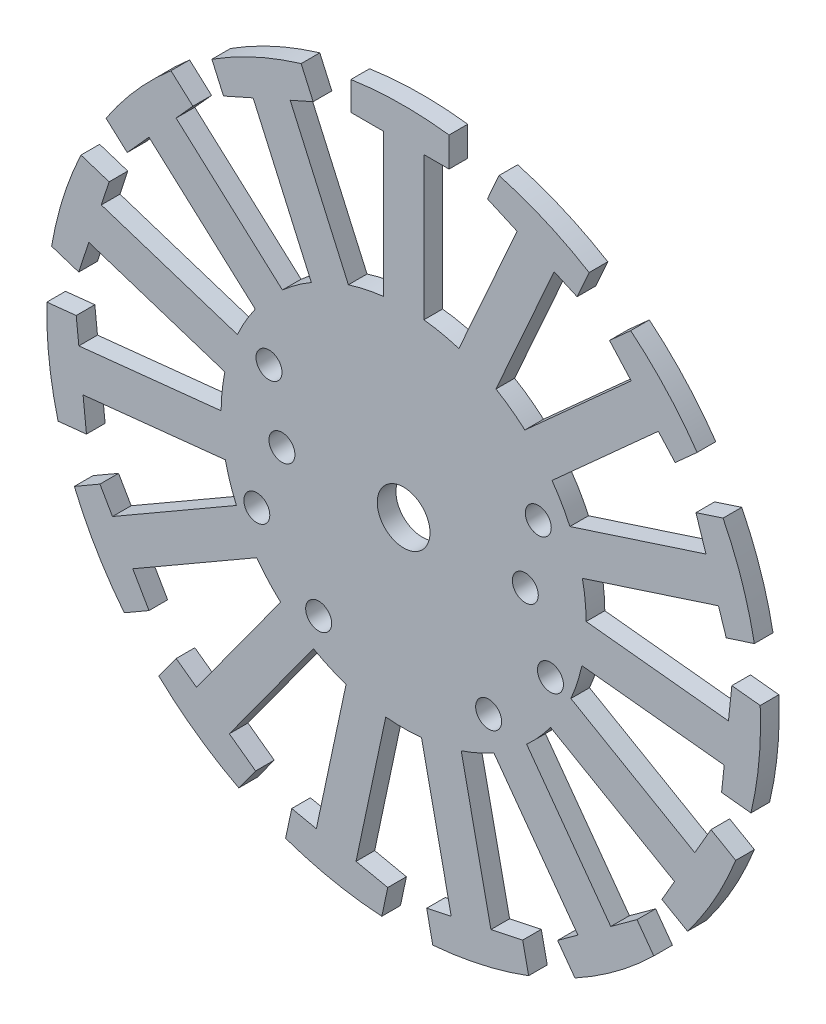
from build123d import *

# Parameters (mm, degrees)
EXTRUDE_2_DEPTH          = 2.3
PATTERN_CIRCULAR_2_COUNT = 15
SKETCH_3_R               = 3.25
CUT_EXTRUDE_2_DEPTH      = 3.2
SKETCH_5_R               = 1.6
CUT_EXTRUDE_3_DEPTH      = 10
SKETCH_6_R               = 1.6
CUT_EXTRUDE_4_DEPTH      = 10


with BuildPart() as part:
    # ｽｹｯﾁ1 → ﾎﾞｽ - 押し出し2 (new body)
    with BuildSketch(Plane.XY):
        with BuildLine():
            Line((2.5, 22.360679775), (2.5, 40))
            Line((2.5, 40), (5.6, 40))
            Line((5.6, 40), (5.6, 43.64218143))
            ThreePointArc((5.6, 43.64218143), (-0.454315658, 43.997654452), (-6.5, 43.517237964))
            Line((-6.5, 43.517237964), (-6.5, 40))
            Line((-6.5, 40), (-2.5, 40))
            Line((-2.5, 40), (-2.5, 22.360679775))
            ThreePointArc((-2.5, 22.360679775), (0, -22.5), (2.5, 22.360679775))
        make_face()
    extrude_2 = extrude(amount=EXTRUDE_2_DEPTH)

    # 円形ﾊﾟﾀｰﾝ2: ﾎﾞｽ - 押し出し2 ×15 about axis
    pattern_circular_2_axis = Axis((0, 0, 2.3), (0, 0, 1))
    for i in range(1, PATTERN_CIRCULAR_2_COUNT):
        add(extrude_2.rotate(pattern_circular_2_axis, i * 360 / PATTERN_CIRCULAR_2_COUNT))

    # ｽｹｯﾁ3 → ｶｯﾄ - 押し出し2 (cut)
    with BuildSketch(Plane.XY.offset(2.3)):
        Circle(SKETCH_3_R)
    extrude(amount=-CUT_EXTRUDE_2_DEPTH, mode=Mode.SUBTRACT)

    # ｽｹｯﾁ5 → ｶｯﾄ - 押し出し3 (cut)
    with BuildSketch(Plane.XY.offset(2.3)):
        with Locations((-15, 0)):
            Circle(SKETCH_5_R)
        with Locations((15, 0)):
            Circle(SKETCH_5_R)
        with Locations((10.4775, -15.75)):
            Circle(SKETCH_5_R)
        with Locations((-10.4775, -15.75)):
            Circle(SKETCH_5_R)
    extrude(amount=-CUT_EXTRUDE_3_DEPTH, mode=Mode.SUBTRACT)

    # ｽｹｯﾁ6 → ｶｯﾄ - 押し出し4 (cut)
    with BuildSketch(Plane.XY.offset(2.3)):
        with Locations((-16.6, 8)):
            Circle(SKETCH_6_R)
        with Locations((-18.1, -8)):
            Circle(SKETCH_6_R)
        with Locations((18.1, -8)):
            Circle(SKETCH_6_R)
        with Locations((16.6, 8)):
            Circle(SKETCH_6_R)
    extrude(amount=-CUT_EXTRUDE_4_DEPTH, mode=Mode.SUBTRACT)


solid = part.part
